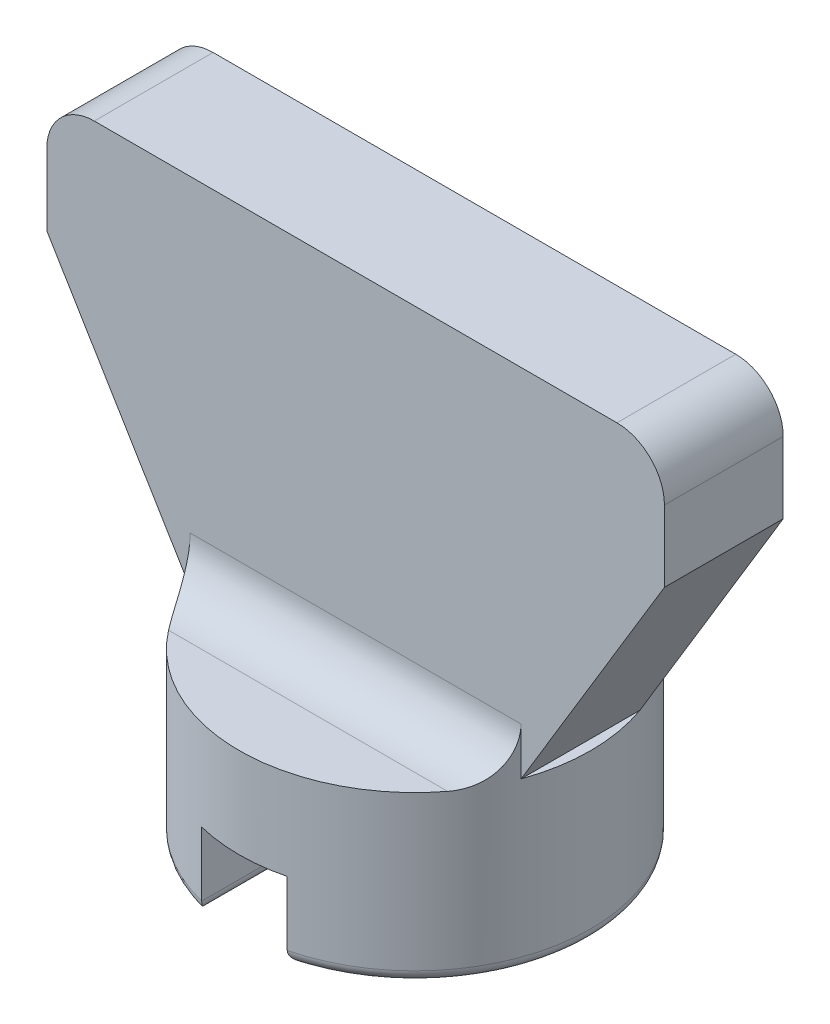
from build123d import *

# Parameters (mm, degrees)
SKETCH1_R           = 7.4
BOSS_EXTRUDE1_DEPTH = 7
SKETCH2_W           = 3.6
SKETCH2_H           = 16.327847923
CUT_EXTRUDE1_DEPTH  = 3.2
FILLET1_R           = 0.5
SKETCH3_W           = 26
SKETCH3_H           = 5
BOSS_EXTRUDE2_DEPTH = 15
CUT_EXTRUDE2_DEPTH  = 28.404561664
FILLET2_R           = 2
FILLET3_R           = 2


with BuildPart() as part:
    # Sketch1 → Boss-Extrude1 (new body)
    with BuildSketch(Plane(origin=(0, 0, 0), x_dir=(1, 0, 0), z_dir=(0, 1, 0))):
        with Locations(Location((0, 0, 0), (0, 0, 270))):
            Circle(SKETCH1_R)
    extrude(amount=BOSS_EXTRUDE1_DEPTH)

    # Sketch2 → Cut-Extrude1 (cut)
    with BuildSketch(Plane.XZ):
        with Locations((0, -0.126477582)):
            Rectangle(SKETCH2_W, SKETCH2_H)
    extrude(amount=-CUT_EXTRUDE1_DEPTH, mode=Mode.SUBTRACT)

    # Fillet1
    fillet1_edges = [part.edges().sort_by_distance(p)[0] for p in [
        (7.4, 0, 0),
        (-7.4, 0, 0),
        (1.8, 0, 0),
        (-1.8, 0, 0),
    ]]
    fillet(fillet1_edges, radius=FILLET1_R)

    # Sketch3 → Boss-Extrude2 (add)
    with BuildSketch(Plane(origin=(0, 7, 0), x_dir=(1, 0, 0), z_dir=(0, 1, 0))):
        Rectangle(SKETCH3_W, SKETCH3_H)
    extrude(amount=BOSS_EXTRUDE2_DEPTH)

    # Sketch4 → Cut-Extrude2 (cut, through all)
    with BuildSketch(Plane.XY.offset(2.5)):
        Polygon((-6.96491206, 7), (-13, 17), (-13, 7), align=None)
        Polygon((6.96491206, 7), (13, 17), (13, 7), align=None)
    extrude(amount=-CUT_EXTRUDE2_DEPTH, mode=Mode.SUBTRACT)

    # Fillet2
    fillet2_edges = [part.edges().sort_by_distance(p)[0] for p in [
        (-13, 22, 0),
        (13, 22, 0),
    ]]
    fillet(fillet2_edges, radius=FILLET2_R)

    # Fillet3
    # the kernel refuses this fillet: 2 mm, written as the material it adds along each edge
    with BuildSketch(Plane(origin=(11.96491206, 7, 2.5), x_dir=(0, 1, 0), z_dir=(-1, 0, 0))) as fillet3_piece_1_section:
        with BuildLine():
            CenterArc((FILLET3_R, -FILLET3_R), FILLET3_R, 90, 90)
            Line((0, -FILLET3_R), (0, 0))
            Line((0, 0), (FILLET3_R, 0))
        make_face()
    fillet3_piece_1 = extrude(amount=23.929824119, mode=Mode.PRIVATE)
    fillet3_piece_1 = fillet3_piece_1 & Plane(origin=(0, 7.46029714, 0), x_dir=(0, 0, 1), z_dir=(0, -1, 0)) * Cylinder(7.4, 56, mode=Mode.PRIVATE)
    add(fillet3_piece_1)
    with BuildSketch(Plane(origin=(-11.96491206, 7, -2.5), x_dir=(0, 1, 0), z_dir=(1, 0, 0))) as fillet3_piece_2_section:
        with BuildLine():
            CenterArc((FILLET3_R, -FILLET3_R), FILLET3_R, 90, 90)
            Line((0, -FILLET3_R), (0, 0))
            Line((0, 0), (FILLET3_R, 0))
        make_face()
    fillet3_piece_2 = extrude(amount=23.929824119, mode=Mode.PRIVATE)
    fillet3_piece_2 = fillet3_piece_2 & Plane(origin=(0, 7.460297172, 0), x_dir=(0, 0, 1), z_dir=(0, -1, 0)) * Cylinder(7.4, 56, mode=Mode.PRIVATE)
    add(fillet3_piece_2)


solid = part.part
